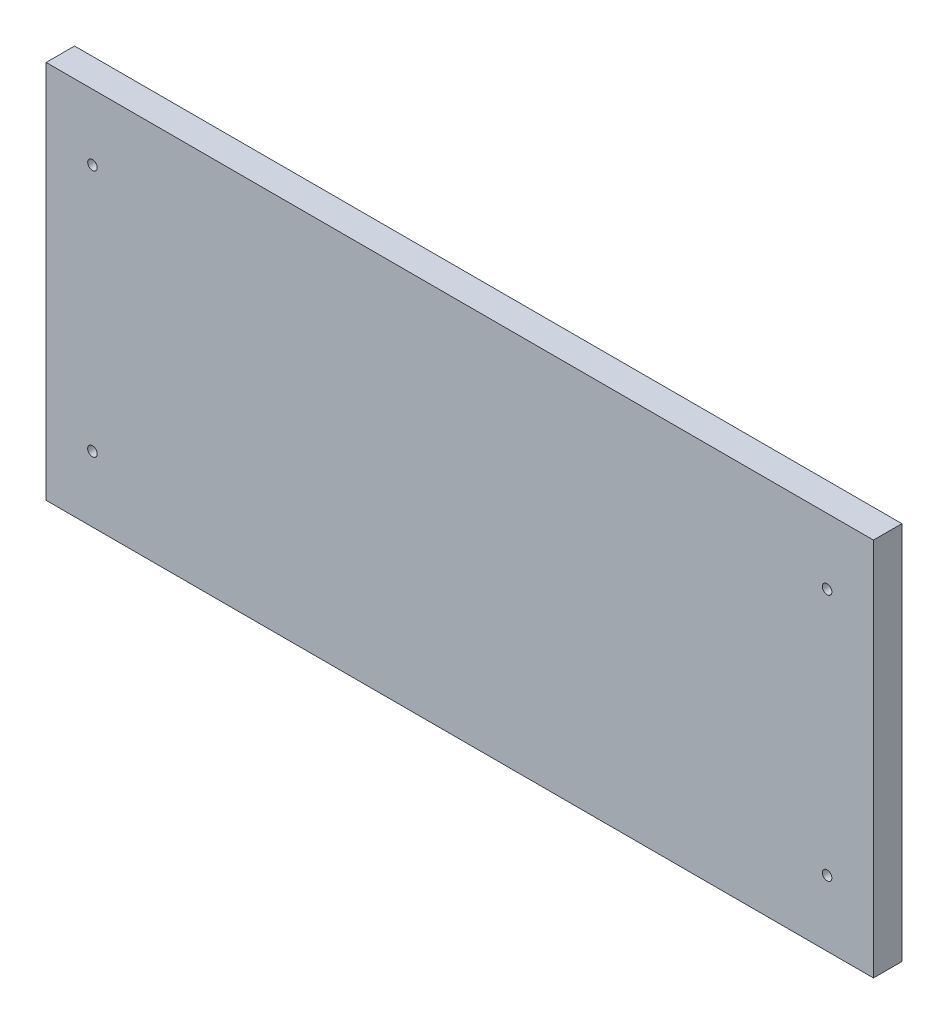
from build123d import *

# Parameters (mm, degrees)
SKETCH1_W  = 277.05
SKETCH1_H  = 127
SKETCH1_R  = 1.6
WALL_DEPTH = 9.525


with BuildPart() as part:
    # Sketch1 → Wall (new body)
    with BuildSketch(Plane.XY):
        with Locations((138.525, 63.5)):
            Rectangle(SKETCH1_W, SKETCH1_H)
        with Locations((15.525, 105)):
            Circle(SKETCH1_R, mode=Mode.SUBTRACT)
        with Locations((15.525, 22)):
            Circle(SKETCH1_R, mode=Mode.SUBTRACT)
        with Locations((261.525, 105)):
            Circle(SKETCH1_R, mode=Mode.SUBTRACT)
        with Locations((261.525, 22)):
            Circle(SKETCH1_R, mode=Mode.SUBTRACT)
    extrude(amount=WALL_DEPTH)


solid = part.part
